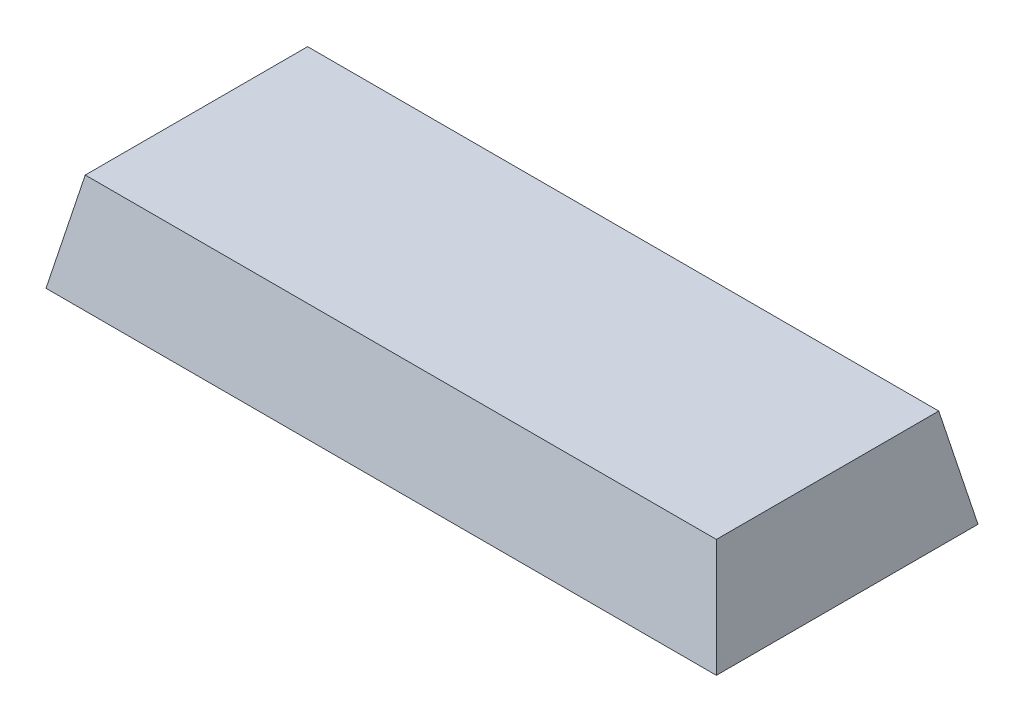
from build123d import *

# Parameters (mm, degrees)
SKETCH1_W               = 20.5
SKETCH1_H               = 8
BOSS_EXTRUDE1_DEPTH     = 3
CUT_EXTRUDE1_DEPTH      = 23.209232315
CUT_EXTRUDE1_DEPTH_BACK = 23.209232315
CUT_EXTRUDE2_DEPTH      = 23.209232315
CUT_EXTRUDE2_DEPTH_BACK = 23.209232315
SKETCH4_R               = 1.75
CUT_EXTRUDE3_DEPTH      = 0.4
SKETCH5_W               = 8
SKETCH5_H               = 1.2
BOSS_EXTRUDE2_DEPTH     = 2
FILLET1_R               = 4


with BuildPart() as part:
    # Sketch1 → Boss-Extrude1 (new body)
    with BuildSketch(Plane(origin=(0, 0, 0), x_dir=(1, 0, 0), z_dir=(0, 1, 0))):
        with Locations((10.25, 4)):
            Rectangle(SKETCH1_W, SKETCH1_H)
    extrude(amount=BOSS_EXTRUDE1_DEPTH)

    # Sketch2 → Cut-Extrude1 (cut, two sides: drawn at the far end of the back side and taken through both)
    with BuildSketch(Plane.XY.offset(-CUT_EXTRUDE1_DEPTH_BACK)):
        Polygon((0, 0), (0.6, 3), (0, 3), align=None)
        Polygon((20.5, 0), (19.9, 3), (20.5, 3), align=None)
    extrude(amount=CUT_EXTRUDE1_DEPTH + CUT_EXTRUDE1_DEPTH_BACK, mode=Mode.SUBTRACT)

    # Sketch3 → Cut-Extrude2 (cut, two sides: drawn at the far end of the back side and taken through both)
    with BuildSketch(Plane(origin=(0, 0, 0), x_dir=(0, 0, -1), z_dir=(1, 0, 0)).offset(-CUT_EXTRUDE2_DEPTH_BACK)):
        Polygon((0, 0), (0.6, 3), (0, 3), align=None)
        Polygon((8, 3), (7.4, 3), (8, 0), align=None)
    extrude(amount=CUT_EXTRUDE2_DEPTH + CUT_EXTRUDE2_DEPTH_BACK, mode=Mode.SUBTRACT)

    # Sketch4 → Cut-Extrude3 (cut)
    with BuildSketch(Plane.XZ):
        with Locations(Location((10.25000125, -3.75, 0), (0, 0, 270))):
            Circle(SKETCH4_R)
    extrude(amount=-CUT_EXTRUDE3_DEPTH, mode=Mode.SUBTRACT)

    # Sketch5 → Boss-Extrude2 (add)
    with BuildSketch(Plane.XZ):
        with Locations((10.250011, -7.4)):
            Rectangle(SKETCH5_W, SKETCH5_H)
    extrude(amount=BOSS_EXTRUDE2_DEPTH)

    # Fillet1
    # the kernel refuses this fillet: 4 mm, written as the material it takes off along each edge
    with BuildSketch(Plane(origin=(14.250011, -2, -16.660254038), x_dir=(0, 1, 0), z_dir=(0, 0, 1)), Plane(origin=(6.250011, -2, 1.860254038), x_dir=(0, 1, 0), z_dir=(0, 0, -1))) as fillet1_piece_1:
        with BuildLine():
            CenterArc((4, 3.464101615), FILLET1_R, 180, 60)
            Line((0, 3.464101615), (-0.08, 3.464101615))
            Line((-0.08, 3.464101615), (-0.08, 0))
            Line((-0.08, 0), (0, -0.08))
            ThreePointArc((0, -0.08), (1, -0.08), (1.96, -0.069282032))
            Line((1.96, -0.069282032), (2, 0))
        make_face()
    extrude(amount=18.520508076, mode=Mode.SUBTRACT)


solid = part.part
